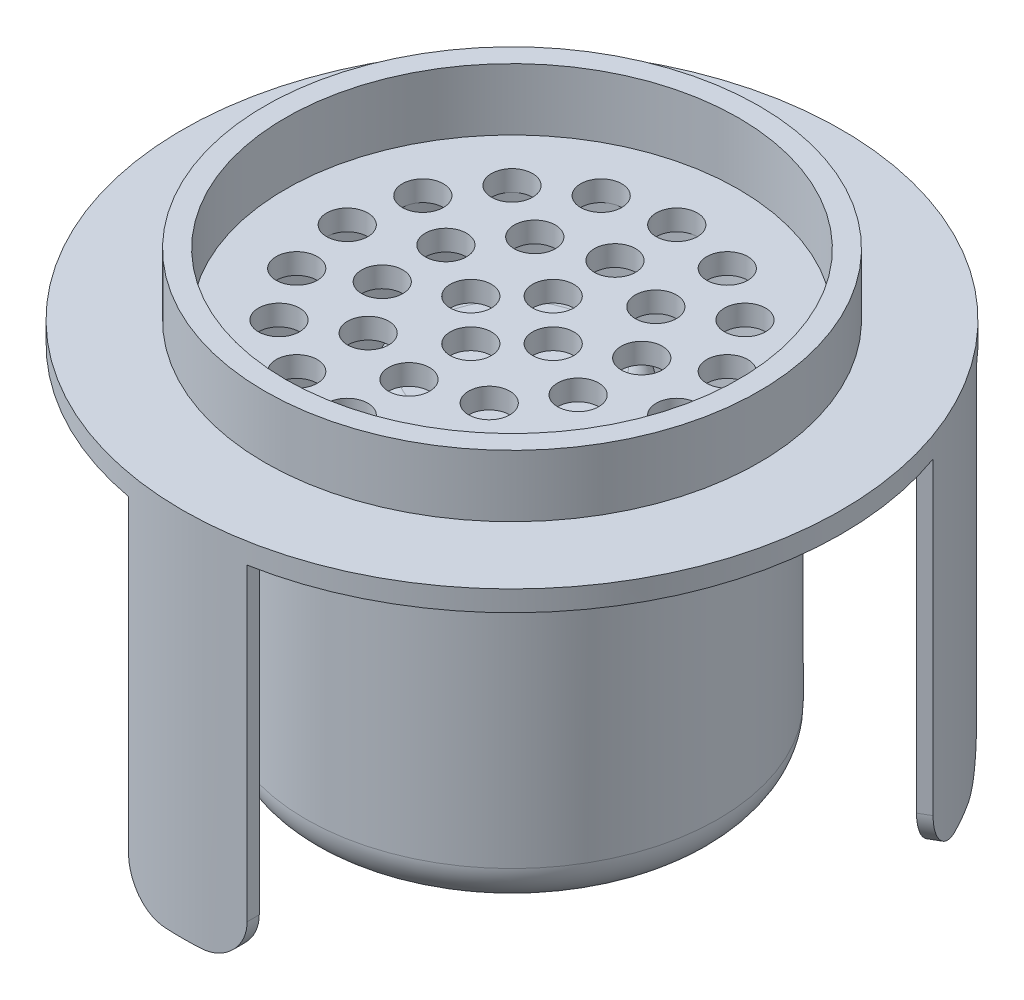
from build123d import *

# Parameters (mm, degrees)
FILLET1_R           = 1
FILLET2_R           = 2
BOSS_EXTRUDE3_DEPTH = 18
SKETCH11_R          = 11
SKETCH11_R_2        = 1
BOSS_EXTRUDE4_DEPTH = 1
CIRPATTERN1_COUNT   = 3
FILLET3_R           = 2


with BuildPart() as part:
    # Sketch1 → Revolve2 (revolve)
    with BuildSketch(Plane.XY, mode=Mode.PRIVATE) as revolve2_sk:
        with BuildLine():
            Line((12, 0), (16, 0))
            Line((16, 0), (16, 1))
            Line((16, 1), (12, 1))
            Line((12, 1), (12, 4))
            Line((12, 4), (11, 4))
            Line((11, 4), (11, 1))
            Line((11, 1), (11, 0))
            Line((11, 0), (9, 0))
            Line((9, 0), (9, -4))
            Line((9, -4), (9, -16))
            Line((9, -16), (5, -16))
            Line((5, -16), (5, -1))
            Line((5, -1), (0, -1))
            Line((0, -1), (0, -2))
            Line((0, -2), (4, -2))
            Line((4, -2), (4, -17))
            Line((4, -17), (10, -17))
            Line((10, -17), (10, -4))
            Line((10, -4), (11, -4))
            Line((11, -4), (11, -1))
            ThreePointArc((11, -1), (11.707107, -0.707107), (12, 0))
        make_face()
    revolve(revolve2_sk.sketch.rotate(Axis((0, 16.584361, 0), (0, -1, 0)), 90), axis=Axis((0, 16.584361, 0), (0, -1, 0)))

    # Fillet1
    fillet1_edges = [part.edges().sort_by_distance(p)[0] for p in [
        (0, -4, -11),
        (0, -2, -4),
        (0, -1, -5),
    ]]
    fillet(fillet1_edges, radius=FILLET1_R - 0.0001)  # a hair under: the kernel refuses the full size

    # Fillet2
    fillet2_edges = [part.edges().sort_by_distance(p)[0] for p in [
        (0, -16, -5),
        (0, -16, -9),
    ]]
    fillet(fillet2_edges, radius=FILLET2_R - 0.0001)  # a hair under: the kernel refuses the full size
    fillet2_2_edges = [part.edges().sort_by_distance(p)[0] for p in [
        (0, -17, -10),
        (0, -17, -4),
    ]]
    fillet(fillet2_2_edges, radius=FILLET2_R)

    # Sketch2 → Boss-Extrude3 (add)
    with BuildSketch(Plane(origin=(0, 1, 0), x_dir=(1, 0, 0), z_dir=(0, 1, 0))):
        with BuildLine():
            Line((-2.877503, -15.149168), (-2.877503, -15.739122))
            ThreePointArc((-2.877503, -15.739122), (0, -16), (2.877503, -15.739122))
            Line((2.877503, -15.739122), (2.877503, -15.149168))
            ThreePointArc((2.877503, -15.149168), (0, -15.42003), (-2.877503, -15.149168))
        make_face()
    boss_extrude3 = extrude(amount=-BOSS_EXTRUDE3_DEPTH)

    # Sketch11 → Boss-Extrude4 (add)
    with BuildSketch(Plane(origin=(0, 0, 0), x_dir=(1, 0, 0), z_dir=(0, 1, 0))):
        with Locations(Location((0, 0, 0), (0, 0, 270))):
            Circle(SKETCH11_R)
        with Locations(Location((0, -2, 0), (0, 0, 270))):
            Circle(SKETCH11_R_2, mode=Mode.SUBTRACT)
        with Locations(Location((0, -5, 0), (0, 0, 270))):
            Circle(SKETCH11_R_2, mode=Mode.SUBTRACT)
        with Locations(Location((0, -8, 0), (0, 0, 269.999141))):
            Circle(SKETCH11_R_2, mode=Mode.SUBTRACT)
        with Locations(Location((-2, 0, 0), (0, 0, 270))):
            Circle(SKETCH11_R_2, mode=Mode.SUBTRACT)
        with Locations(Location((0, 2, 0), (0, 0, 270))):
            Circle(SKETCH11_R_2, mode=Mode.SUBTRACT)
        with Locations(Location((2, 0, 0), (0, 0, 270))):
            Circle(SKETCH11_R_2, mode=Mode.SUBTRACT)
        with Locations(Location((-2.938926, -4.045085, 0), (0, 0, 270))):
            Circle(SKETCH11_R_2, mode=Mode.SUBTRACT)
        with Locations(Location((-4.755283, -1.545085, 0), (0, 0, 270))):
            Circle(SKETCH11_R_2, mode=Mode.SUBTRACT)
        with Locations(Location((-4.755283, 1.545085, 0), (0, 0, 270))):
            Circle(SKETCH11_R_2, mode=Mode.SUBTRACT)
        with Locations(Location((-2.938926, 4.045085, 0), (0, 0, 270))):
            Circle(SKETCH11_R_2, mode=Mode.SUBTRACT)
        with Locations(Location((0, 5, 0), (0, 0, 270))):
            Circle(SKETCH11_R_2, mode=Mode.SUBTRACT)
        with Locations(Location((2.938926, 4.045085, 0), (0, 0, 270))):
            Circle(SKETCH11_R_2, mode=Mode.SUBTRACT)
        with Locations(Location((4.755283, 1.545085, 0), (0, 0, 270))):
            Circle(SKETCH11_R_2, mode=Mode.SUBTRACT)
        with Locations(Location((4.755283, -1.545085, 0), (0, 0, 270))):
            Circle(SKETCH11_R_2, mode=Mode.SUBTRACT)
        with Locations(Location((2.938926, -4.045085, 0), (0, 0, 270))):
            Circle(SKETCH11_R_2, mode=Mode.SUBTRACT)
        with Locations(Location((-3.061467, -7.391036, 0), (0, 0, 247.499141))):
            Circle(SKETCH11_R_2, mode=Mode.SUBTRACT)
        with Locations(Location((-5.656854, -5.656854, 0), (0, 0, 224.999141))):
            Circle(SKETCH11_R_2, mode=Mode.SUBTRACT)
        with Locations(Location((-7.391036, -3.061467, 0), (0, 0, 202.499141))):
            Circle(SKETCH11_R_2, mode=Mode.SUBTRACT)
        with Locations(Location((-8, 0, 0), (0, 0, 179.999141))):
            Circle(SKETCH11_R_2, mode=Mode.SUBTRACT)
        with Locations(Location((-7.391036, 3.061467, 0), (0, 0, 157.499141))):
            Circle(SKETCH11_R_2, mode=Mode.SUBTRACT)
        with Locations(Location((-5.656854, 5.656854, 0), (0, 0, 134.999141))):
            Circle(SKETCH11_R_2, mode=Mode.SUBTRACT)
        with Locations(Location((-3.061467, 7.391036, 0), (0, 0, 112.499141))):
            Circle(SKETCH11_R_2, mode=Mode.SUBTRACT)
        with Locations(Location((0, 8, 0), (0, 0, 89.999141))):
            Circle(SKETCH11_R_2, mode=Mode.SUBTRACT)
        with Locations(Location((3.061467, 7.391036, 0), (0, 0, 67.499141))):
            Circle(SKETCH11_R_2, mode=Mode.SUBTRACT)
        with Locations(Location((5.656854, 5.656854, 0), (0, 0, 44.999141))):
            Circle(SKETCH11_R_2, mode=Mode.SUBTRACT)
        with Locations(Location((7.391036, 3.061467, 0), (0, 0, 22.499141))):
            Circle(SKETCH11_R_2, mode=Mode.SUBTRACT)
        with Locations(Location((8, 0, 0), (0, 0, 359.999141))):
            Circle(SKETCH11_R_2, mode=Mode.SUBTRACT)
        with Locations(Location((7.391036, -3.061467, 0), (0, 0, 337.499141))):
            Circle(SKETCH11_R_2, mode=Mode.SUBTRACT)
        with Locations(Location((5.656854, -5.656854, 0), (0, 0, 314.999141))):
            Circle(SKETCH11_R_2, mode=Mode.SUBTRACT)
        with Locations(Location((3.061467, -7.391036, 0), (0, 0, 292.499141))):
            Circle(SKETCH11_R_2, mode=Mode.SUBTRACT)
    extrude(amount=BOSS_EXTRUDE4_DEPTH)

    # CirPattern1: Boss-Extrude3 ×3 about axis
    cirpattern1_axis = Axis((0, 0, 0), (0, 1, 0))
    for i in range(1, CIRPATTERN1_COUNT):
        add(boss_extrude3.rotate(cirpattern1_axis, i * 360 / CIRPATTERN1_COUNT))

    # Fillet3
    fillet3_edges = [part.edges().sort_by_distance(p)[0] for p in [
        (11.936271, -17, -10.214063),
        (14.813774, -17, -5.230082),
        (-14.813774, -17, -5.230082),
        (-11.936271, -17, -10.214063),
        (2.877503, -17, 15.444145),
        (-2.877503, -17, 15.444145),
    ]]
    fillet(fillet3_edges, radius=FILLET3_R)


solid = part.part
